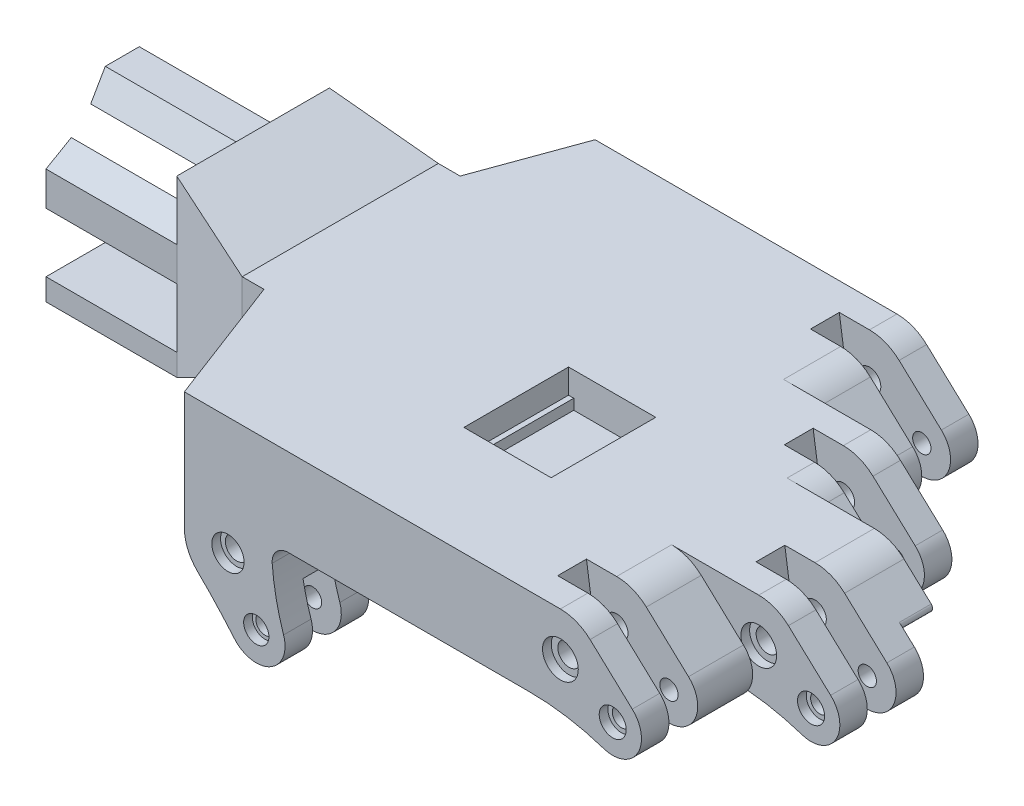
from build123d import *

# Parameters (mm, degrees)
SKETCH1_R                = 2.6
SKETCH1_R_2              = 2.1
BOSS_EXTRUDE1_DEPTH      = 19.2
CUT_EXTRUDE1_DEPTH       = 3.3
CUT_EXTRUDE1_DEPTH_BACK  = 3.3
FILLET1_R                = 4.6
CUT_EXTRUDE6_START       = 2
SKETCH5_R                = 4.1
SKETCH5_R_2              = 2.6
SKETCH5_R_3              = 3.1
CUT_EXTRUDE6_DEPTH       = 2
SKETCH12_R               = 4.1
SKETCH12_R_2             = 3.1
CUT_EXTRUDE7_DEPTH       = 2
SKETCH13_R               = 3.7
SKETCH13_R_2             = 3.1
SKETCH13_R_3             = 4.1
CUT_EXTRUDE8_DEPTH       = 2
SKETCH14_R               = 4.1
SKETCH14_R_2             = 3.1
CUT_EXTRUDE9_DEPTH       = 2
BOSS_EXTRUDE4_DEPTH      = 10
BOSS_EXTRUDE4_DEPTH_BACK = 10
SKETCH9_R                = 2.6
SKETCH9_R_2              = 2.1
BOSS_EXTRUDE3_DEPTH      = 19.2
CUT_EXTRUDE5_DEPTH       = 3.3
CUT_EXTRUDE5_DEPTH_BACK  = 3.3
FILLET3_R                = 5.4
SKETCH18_R               = 2.9
SKETCH18_R_2             = 3.7
CUT_EXTRUDE10_DEPTH      = 2
BOSS_EXTRUDE5_DEPTH      = 6.8
BOSS_EXTRUDE7_START      = 7.3
BOSS_EXTRUDE7_DEPTH      = 7.3
SKETCH19_W               = 20
SKETCH19_H               = 24
CUT_EXTRUDE11_DEPTH      = 8
SKETCH20_R               = 1.45
SKETCH20_W               = 1.2
SKETCH20_H               = 24
BOSS_EXTRUDE8_DEPTH      = 2.4
BOSS_EXTRUDE9_START      = 6.3
BOSS_EXTRUDE9_DEPTH      = 6.3
CUT_EXTRUDE12_START      = -6.3
CUT_EXTRUDE12_DEPTH      = 6.3
FILLET4_R                = 3.7
SKETCH24_W               = 35
SKETCH24_H               = 5
BOSS_EXTRUDE10_DEPTH     = 30
CUT_EXTRUDE13_REACH      = 177.898
SKETCH26_R               = 2.5
SKETCH27_R               = 5.5
CUT_EXTRUDE14_DEPTH      = 30


with BuildPart() as part:
    # Sketch1 → Boss-Extrude1 (new body)
    with BuildSketch(Plane.XY):
        with BuildLine():
            Line((0, 10), (-7.5, 10))
            Line((-7.5, 10), (-7.5, -10))
            Line((-7.5, -10), (-7.13400115, -10))
            ThreePointArc((-7.13400115, -10), (1.502210891, -10.69506738), (9.916098885, -12.762376238))
            ThreePointArc((9.916098885, -12.762376238), (17.678703862, -9.863379618), (16.490151831, -1.66279662))
            Line((16.490151831, -1.66279662), (6.80326035, 7.32909603))
            ThreePointArc((6.80326035, 7.32909603), (3.654383648, 9.308355394), (0, 10))
        make_face()
        Circle(SKETCH1_R, mode=Mode.SUBTRACT)
        with Locations((12, -6.5)):
            Circle(SKETCH1_R_2, mode=Mode.SUBTRACT)
    extrude(amount=BOSS_EXTRUDE1_DEPTH)

    # Sketch2 → Cut-Extrude1 (cut, two sides: drawn at the far end of the back side and taken through both)
    with BuildSketch(Plane(origin=(0, 0, 9.6), x_dir=(-1, 0, 0), z_dir=(0, 0, -1)).offset(-CUT_EXTRUDE1_DEPTH_BACK)):
        with BuildLine():
            Line((-6.80326035, 7.32909603), (-16.490151831, -1.66279662))
            ThreePointArc((-16.490151831, -1.66279662), (-17.678703862, -9.863379618), (-9.916098885, -12.762376238))
            ThreePointArc((-9.916098885, -12.762376238), (-6.386132264, -11.719927386), (-2.793352828, -10.920365082))
            ThreePointArc((-2.793352828, -10.920365082), (1.091484848, -6.627439321), (5.09895648, -2.448761722))
            Line((5.09895648, -2.448761722), (6.922254539, 10))
            Line((6.922254539, 10), (0, 10))
            ThreePointArc((0, 10), (-3.654383648, 9.308355394), (-6.80326035, 7.32909603))
        make_face()
    extrude(amount=CUT_EXTRUDE1_DEPTH + CUT_EXTRUDE1_DEPTH_BACK, mode=Mode.SUBTRACT)

    # Fillet1
    fillet1_edges = [part.edges().sort_by_distance(p)[0] for p in [
        (-5.09895648, -2.448761722, 9.6),
    ]]
    fillet(fillet1_edges, radius=FILLET1_R)


with BuildPart() as body_2:
    # Body-Move/Copy1: copy of part
    add(part.part.moved(Location((20, 0, -25.5))))


with BuildPart() as body_3:
    # Body-Move/Copy4: copy of body 2
    add(body_2.part.moved(Location((-20, 0, -26.5))))


with BuildPart() as body_4:
    # Body-Move/Copy5: copy of body 3
    add(body_3.part.moved(Location((-20, 0, -26))))

    # Sketch12 → Cut-Extrude7 (cut)
    with BuildSketch(Plane(origin=(0, 0, -78), x_dir=(-1, 0, 0), z_dir=(0, 0, -1))):
        with Locations((20, 0)):
            Circle(SKETCH12_R)
        with Locations((8, -6.5)):
            Circle(SKETCH12_R_2)
    extrude(amount=-CUT_EXTRUDE7_DEPTH, mode=Mode.SUBTRACT)


with BuildPart() as part_1:
    add(part.part)

    # Sketch5 → Cut-Extrude6 (cut)
    # profile 1 of 2: a face of its own
    with BuildSketch(Plane(origin=(0, 0, 19.2), x_dir=(-1, 0, 0), z_dir=(0, 0, -1)).offset(CUT_EXTRUDE6_START)):
        with Locations(Location((0, 0, 0), (0, 0, 180))):
            Circle(SKETCH5_R)
        Circle(SKETCH5_R_2, mode=Mode.SUBTRACT)
    # profile 2 of 2: a face of its own
    with BuildSketch(Plane(origin=(0, 0, 19.2), x_dir=(-1, 0, 0), z_dir=(0, 0, -1)).offset(CUT_EXTRUDE6_START)):
        with Locations((-12, -6.5)):
            Circle(SKETCH5_R_3)
    extrude(amount=-CUT_EXTRUDE6_DEPTH, mode=Mode.SUBTRACT)



with BuildPart() as body_3_1:
    add(body_3.part)

    # Sketch13 → Cut-Extrude8 (cut)
    with BuildSketch(Plane(origin=(0, 0, -52), x_dir=(-1, 0, 0), z_dir=(0, 0, -1))):
        with Locations((-93.971834881, -31.735594924)):
            Circle(SKETCH13_R)
        with Locations((-12, -6.5)):
            Circle(SKETCH13_R_2)
        with Locations(Location((0, 0, 0), (0, 0, 180))):
            Circle(SKETCH13_R_3)
    extrude(amount=-CUT_EXTRUDE8_DEPTH, mode=Mode.SUBTRACT)


with BuildPart() as body_2_1:
    add(body_2.part)

    # Sketch14 → Cut-Extrude9 (cut)
    with BuildSketch(Plane.XY.offset(-6.3)):
        with Locations((20, 0)):
            Circle(SKETCH14_R)
        with Locations((32, -6.5)):
            Circle(SKETCH14_R_2)
    extrude(amount=-CUT_EXTRUDE9_DEPTH, mode=Mode.SUBTRACT)


with BuildPart() as part_2:
    add(part_1.part)

    add(body_2_1.part)  # Boss-Extrude4 merges body 2

    add(body_3_1.part)  # Boss-Extrude4 merges body 3

    add(body_4.part)  # Boss-Extrude4 merges body 4
    # Sketch8 → Boss-Extrude4 (add, two sides: drawn at the far end of the back side and taken through both)
    with BuildSketch(Plane(origin=(0, 0, 0), x_dir=(1, 0, 0), z_dir=(0, 1, 0)).offset(-BOSS_EXTRUDE4_DEPTH_BACK)):
        Polygon((-27.5, 78), (-27.5, 52), (-7.5, 52), (-7.5, 32.8), (12.5, 32.8), (12.5, 0), (-7.5, 0), (-7.5, -19.2), (-86.262878089, -19.2), (-97.5, 10.3), (-102.5, 10.3), (-102.5, 55.3), (-97.5, 55.3), (-89.237875682, 78), align=None)
    extrude(amount=BOSS_EXTRUDE4_DEPTH + BOSS_EXTRUDE4_DEPTH_BACK)

    # Sketch16 → Boss-Extrude5 (add)
    with BuildSketch(Plane.XY.offset(-58.8)):
        with BuildLine():
            Line((-20, 10), (-27.5, 10))
            Line((-27.5, 10), (-27.5, -10))
            Line((-27.5, -10), (-27.13400115, -10))
            ThreePointArc((-27.13400115, -10), (-18.497789109, -10.69506738), (-10.083901115, -12.762376238))
            ThreePointArc((-10.083901115, -12.762376238), (-2.321296138, -9.863379618), (-3.509848169, -1.66279662))
            Line((-3.509848169, -1.66279662), (-13.19673965, 7.32909603))
            ThreePointArc((-13.19673965, 7.32909603), (-16.345616352, 9.308355394), (-20, 10))
        make_face()
    extrude(amount=BOSS_EXTRUDE5_DEPTH)

    # Sketch17 → Boss-Extrude7 (add)
    with BuildSketch(Plane(origin=(0, 0, -25.5), x_dir=(-1, 0, 0), z_dir=(0, 0, -1)).offset(BOSS_EXTRUDE7_START)):
        with BuildLine():
            Line((-33.057974425, 1.523134681), (-26.80326035, 7.32909603))
            ThreePointArc((-26.80326035, 7.32909603), (-23.654383648, 9.308355394), (-20, 10))
            Line((-20, 10), (-12.5, 10))
            Line((-12.5, 10), (-12.5, -10))
            Line((-12.5, -10), (-12.86599885, -10))
            ThreePointArc((-12.86599885, -10), (-19.333187826, -10.38866289), (-25.707282122, -11.549056787))
            ThreePointArc((-25.707282122, -11.549056787), (-26.765244836, -11.149875571), (-26.774524258, -10.019148089))
            ThreePointArc((-26.774524258, -10.019148089), (-26.516940587, -3.397410843), (-32.325915734, -0.208435891))
            ThreePointArc((-32.325915734, -0.208435891), (-33.298716559, 0.400823706), (-33.057974425, 1.523134681))
        make_face()
    extrude(amount=-BOSS_EXTRUDE7_DEPTH)

    # Sketch19 → Cut-Extrude11 (cut)
    with BuildSketch(Plane(origin=(0, 10, 0), x_dir=(1, 0, 0), z_dir=(0, 1, 0))):
        with Locations((-37.13400115, 17.8)):
            Rectangle(SKETCH19_W, SKETCH19_H)
    extrude(amount=-CUT_EXTRUDE11_DEPTH, mode=Mode.SUBTRACT)

    # Sketch20 → Boss-Extrude8 (add)
    # profile 1 of 3: a face of its own
    with BuildSketch(Plane(origin=(0, 2, 0), x_dir=(1, 0, 0), z_dir=(0, 1, 0))):
        with BuildLine():
            Line((-31.53400115, 27.05), (-31.53400115, 29.8))
            Line((-31.53400115, 29.8), (-27.13400115, 29.8))
            Line((-27.13400115, 29.8), (-27.13400115, 25))
            Line((-27.13400115, 25), (-29.48400115, 25))
            ThreePointArc((-29.48400115, 25), (-30.933570051, 25.600431099), (-31.53400115, 27.05))
        make_face()
        with Locations(Location((-29.48400115, 27.05, 0), (0, 0, 270))):
            Circle(SKETCH20_R, mode=Mode.SUBTRACT)
    # profile 2 of 3: a face of its own
    with BuildSketch(Plane(origin=(0, 2, 0), x_dir=(1, 0, 0), z_dir=(0, 1, 0))):
        with Locations((-46.53400115, 17.8)):
            Rectangle(SKETCH20_W, SKETCH20_H)
    # profile 3 of 3: a face of its own
    with BuildSketch(Plane(origin=(0, 2, 0), x_dir=(1, 0, 0), z_dir=(0, 1, 0))):
        with BuildLine():
            Line((-31.53400115, 8.3), (-31.53400115, 5.8))
            Line((-31.53400115, 5.8), (-27.13400115, 5.8))
            Line((-27.13400115, 5.8), (-27.13400115, 10.35))
            Line((-27.13400115, 10.35), (-29.48400115, 10.35))
            ThreePointArc((-29.48400115, 10.35), (-30.933570051, 9.749568901), (-31.53400115, 8.3))
        make_face()
        with Locations(Location((-29.48400115, 8.3, 0), (0, 0, 270))):
            Circle(SKETCH20_R, mode=Mode.SUBTRACT)
    extrude(amount=BOSS_EXTRUDE8_DEPTH)

    # Sketch21 → Boss-Extrude9 (add)
    with BuildSketch(Plane(origin=(0, 0, 0), x_dir=(-1, 0, 0), z_dir=(0, 0, -1)).offset(BOSS_EXTRUDE9_START)):
        with BuildLine():
            Line((-16.490151831, -1.66279662), (-12.5, 2.041076494))
            Line((-12.5, 2.041076494), (-12.5, -10))
            Line((-12.5, -10), (7.13400115, -10))
            ThreePointArc((7.13400115, -10), (-1.502210891, -10.69506738), (-9.916098885, -12.762376238))
            ThreePointArc((-9.916098885, -12.762376238), (-17.678703862, -9.863379618), (-16.490151831, -1.66279662))
        make_face()
    extrude(amount=-BOSS_EXTRUDE9_DEPTH)

    # Sketch22 → Cut-Extrude12 (cut)
    with BuildSketch(Plane.XY.offset(CUT_EXTRUDE12_START)):
        with BuildLine():
            Line((6.80326035, 7.32909603), (12.5, 2.041076494))
            Line((12.5, 2.041076494), (12.5, 10))
            Line((12.5, 10), (0, 10))
            ThreePointArc((0, 10), (3.654383648, 9.308355394), (6.80326035, 7.32909603))
        make_face()
    extrude(amount=CUT_EXTRUDE12_DEPTH, mode=Mode.SUBTRACT)


with BuildPart() as body_2_2:
    # Sketch9 → Boss-Extrude3 (new body)
    with BuildSketch(Plane(origin=(-9.122151388, 55.940605223, 0), x_dir=(1, 0, 0), z_dir=(0, 0, 1))):
        with BuildLine():
            Line((-54.528951134, -67.288709072), (-74.528951134, -67.288709072))
            Line((-74.528951134, -67.288709072), (-74.528951134, -74.288709072))
            ThreePointArc((-74.528951134, -74.288709072), (-73.744289366, -78.171690049), (-71.51344288, -81.445305683))
            ThreePointArc((-71.51344288, -81.445305683), (-67.18610386, -85.883704512), (-63.084503899, -90.531513126))
            ThreePointArc((-63.084503899, -90.531513126), (-54.80680899, -92.048726433), (-51.767844481, -84.200996574))
            ThreePointArc((-51.767844481, -84.200996574), (-53.750141241, -76.325449637), (-54.528951134, -68.241688436))
            Line((-54.528951134, -68.241688436), (-54.528951134, -67.288709072))
        make_face()
        with Locations((-64.528951134, -74.288709072)):
            Circle(SKETCH9_R, mode=Mode.SUBTRACT)
        with Locations((-58.028951134, -86.288709072)):
            Circle(SKETCH9_R_2, mode=Mode.SUBTRACT)
    extrude(amount=BOSS_EXTRUDE3_DEPTH)

    # Sketch10 → Cut-Extrude5 (cut, two sides: drawn at the far end of the back side and taken through both)
    with BuildSketch(Plane(origin=(0, 0, 9.6), x_dir=(-1, 0, 0), z_dir=(0, 0, -1)).offset(-CUT_EXTRUDE5_DEPTH_BACK)):
        with BuildLine():
            Line((83.651102522, -18.34810385), (83.651102522, -11.42584931))
            Line((83.651102522, -11.42584931), (71.2023408, -13.249147369))
            ThreePointArc((71.2023408, -13.249147369), (67.026670131, -17.253650594), (62.736917975, -21.135698771))
            ThreePointArc((62.736917975, -21.135698771), (61.934984942, -24.729548566), (60.889995869, -28.260391351))
            ThreePointArc((60.889995869, -28.260391351), (63.928960377, -36.108121211), (72.206655287, -34.590907904))
            ThreePointArc((72.206655287, -34.590907904), (76.308255248, -29.943099289), (80.635594268, -25.50470046))
            ThreePointArc((80.635594268, -25.50470046), (82.866440754, -22.231084827), (83.651102522, -18.34810385))
        make_face()
    extrude(amount=CUT_EXTRUDE5_DEPTH + CUT_EXTRUDE5_DEPTH_BACK, mode=Mode.SUBTRACT)

    # Fillet3
    fillet3_edges = [body_2_2.edges().sort_by_distance(p)[0] for p in [
        (-71.2023408, -13.249147369, 9.6),
    ]]
    fillet(fillet3_edges, radius=FILLET3_R)

    # Sketch18 → Cut-Extrude10 (cut)
    with BuildSketch(Plane.XY.offset(19.2)):
        with Locations((-67.151102522, -30.34810385)):
            Circle(SKETCH18_R)
        with Locations((-73.651102522, -18.34810385)):
            Circle(SKETCH18_R_2)
    extrude(amount=-CUT_EXTRUDE10_DEPTH, mode=Mode.SUBTRACT)


with BuildPart() as body_2_2_1:
    # Body-Move/Copy6: moved
    add(body_2_2.part.moved(Location((-2.611775567, 1.34810385, 0))))


with BuildPart() as part_3:
    add(part_2.part)

    # Combine1: union body 2 2
    add(body_2_2_1.part)

    # Fillet4
    fillet4_edges = [part_3.edges().sort_by_distance(p)[0] for p in [
        (-76.262878089, -10, 0),
        (-66.262878089, -10, 9.6),
    ]]
    fillet(fillet4_edges, radius=FILLET4_R)

    # Boundary1: read off the stored shape, not the designer's step
    # Boundary1: loft between two sections, ruled curve by curve
    boundary1_from = [
        Edge.make_line((-102.5, 10, -55.3), (-102.5, -10, -55.3)),
        Edge.make_line((-102.5, -10, -10.3), (-102.5, -10, -55.3)),
        Edge.make_line((-102.5, 10, -10.3), (-102.5, -10, -10.3)),
        Edge.make_line((-102.5, 10, -10.3), (-102.5, 10, -55.3)),
    ]
    boundary1_to = [
        Edge.make_line((-122.5, 17.5, -50.3), (-122.5, -22.5, -50.3)),
        Edge.make_line((-122.5, -22.5, -15.3), (-122.5, -22.5, -50.3)),
        Edge.make_line((-122.5, 17.5, -15.3), (-122.5, -22.5, -15.3)),
        Edge.make_line((-122.5, 17.5, -15.3), (-122.5, 17.5, -50.3)),
    ]
    boundary1 = Solid(Shell([*[Face.make_surface_from_curves(boundary1_from[k], boundary1_to[k]) for k in range(4)], Face(Wire(boundary1_from)), Face(Wire(boundary1_to))]))
    add(boundary1)

    # Sketch24 → Boss-Extrude10 (add)
    with BuildSketch(Plane.ZY.offset(122.5)):
        with Locations((-32.8, -20)):
            Rectangle(SKETCH24_W, SKETCH24_H)
        Polygon((-50.3, -3.9), (-44.5, -7.248631561), (-44.5, 7.248631561), (-50.3, 3.9), align=None)
        Polygon((-36.7, 17.5), (-40.048631561, 11.7), (-25.551368439, 11.7), (-28.9, 17.5), align=None)
        Polygon((-15.3, 3.9), (-21.1, 7.248631561), (-21.1, -7.248631561), (-15.3, -3.9), align=None)
    extrude(amount=BOSS_EXTRUDE10_DEPTH)

    # Sketch26 → Cut-Extrude13 (cut, up to next)
    with BuildSketch(Plane.XZ.offset(22.5), mode=Mode.PRIVATE) as cut_extrude13_sk1:
        with Locations(Location((-137.5, -32.8, 0), (0, 0, 270))):
            Circle(SKETCH26_R)
    cut_extrude13_tool1 = extrude(cut_extrude13_sk1.sketch, amount=-CUT_EXTRUDE13_REACH, mode=Mode.PRIVATE) & part_3.part
    add(cut_extrude13_tool1.solids().sort_by_distance((-137.5, -22.5, -32.8))[0], mode=Mode.SUBTRACT)

    # Sketch27 → Cut-Extrude14 (cut)
    with BuildSketch(Plane.ZY.offset(122.5)):
        with Locations((-32.8, 0)):
            Circle(SKETCH27_R)
    extrude(amount=-CUT_EXTRUDE14_DEPTH, mode=Mode.SUBTRACT)


solid = part_3.part
